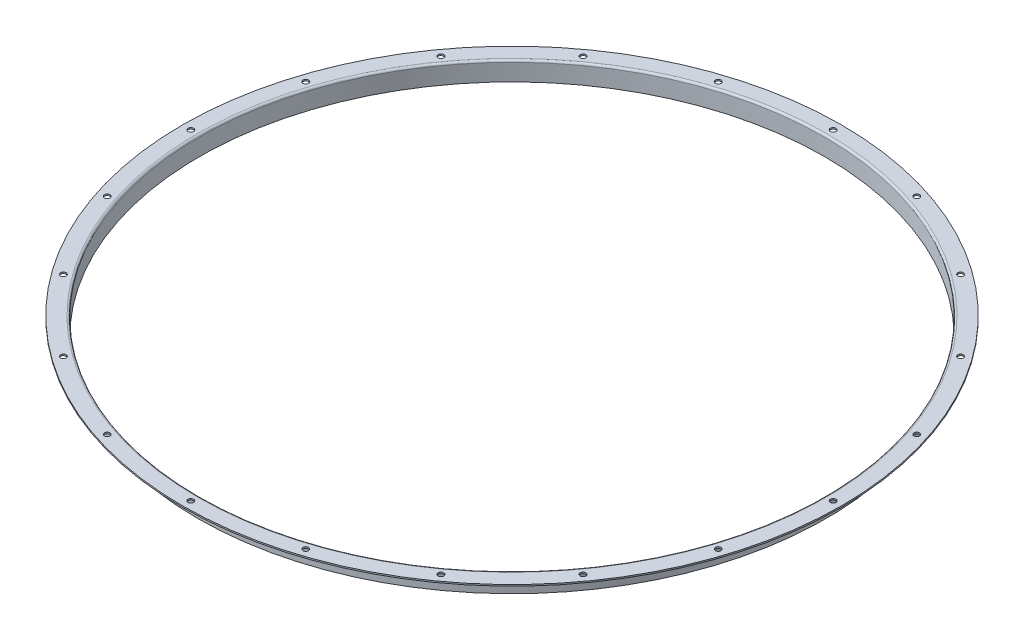
from build123d import *

# Parameters (mm, degrees)
SKETCH1_R          = 582.5
SKETCH1_R_2        = 552.5
BASE_FLANGE1_DEPTH = 2.5
SKETCH8_R          = 5
CUT_EXTRUDE1_DEPTH = 10


# Read off the part's stored shape, not the designer's step: Edge-Flange1
# Sheet-metal steps are written as plain solids
with BuildPart() as part:
    # Sketch1 → Base-Flange1 (new body)
    with BuildSketch(Plane(origin=(0, 0, 0), x_dir=(1, 0, 0), z_dir=(0, 1, 0))):
        with Locations(Location((0, 0, 0), (0, 0, 270))):
            Circle(SKETCH1_R)
        with Locations(Location((0, 0, 0), (0, 0, 270))):
            Circle(SKETCH1_R_2, mode=Mode.SUBTRACT)
    extrude(amount=-BASE_FLANGE1_DEPTH)

    # Edge-Flange1 outline → Edge-Flange1 (revolve, cut)
    with BuildSketch(Plane.XY):
        with BuildLine():
            Line((552.5, -2.5), (552.645898034, -2.5))
            ThreePointArc((552.645898034, -2.5), (553.908349934, -0.69375696), (556, 0))
            Line((556, 0), (552.5, 0))
            Line((552.5, 0), (552.5, -2.5))
        make_face()
    revolve(axis=Axis((0, 0, 0), (0, 1, 0)), mode=Mode.SUBTRACT)

    # Edge-Flange1 2 outline → Edge-Flange1 2 (revolve)
    with BuildSketch(Plane.XY):
        with BuildLine():
            Line((552.5, -3.5), (552.5, -33.5))
            Line((552.5, -33.5), (555, -33.5))
            Line((555, -33.5), (555, -3.5))
            ThreePointArc((555, -3.5), (555.292893219, -2.792893219), (556, -2.5))
            Line((556, -2.5), (552.645898034, -2.5))
            ThreePointArc((552.645898034, -2.5), (552.536666571, -2.994706462), (552.5, -3.5))
        make_face()
    revolve(axis=Axis((0, 0, 0), (0, 1, 0)))

    # Sketch8 → Cut-Extrude1 (cut)
    with BuildSketch(Plane(origin=(0, 0, 0), x_dir=(1, 0, 0), z_dir=(0, 1, 0))):
        with Locations(Location((175.367144308, 539.724572998, 0), (0, 0, 270))):
            Circle(SKETCH8_R)
        with Locations(Location((333.568130676, 459.117144308, 0), (0, 0, 270))):
            Circle(SKETCH8_R)
        with Locations(Location((0, 567.5, 0), (0, 0, 270))):
            Circle(SKETCH8_R)
        with Locations(Location((459.117144308, 333.568130676, 0), (0, 0, 270))):
            Circle(SKETCH8_R)
        with Locations(Location((539.724572998, 175.367144308, 0), (0, 0, 270))):
            Circle(SKETCH8_R)
        with Locations(Location((567.5, 0, 0), (0, 0, 270))):
            Circle(SKETCH8_R)
        with Locations(Location((539.724572998, -175.367144308, 0), (0, 0, 270))):
            Circle(SKETCH8_R)
        with Locations(Location((459.117144308, -333.568130676, 0), (0, 0, 270))):
            Circle(SKETCH8_R)
        with Locations(Location((333.568130676, -459.117144308, 0), (0, 0, 270))):
            Circle(SKETCH8_R)
        with Locations(Location((175.367144308, -539.724572997, 0), (0, 0, 270))):
            Circle(SKETCH8_R)
        with Locations(Location((0, -567.5, 0), (0, 0, 270))):
            Circle(SKETCH8_R)
        with Locations(Location((-175.367144308, -539.724572998, 0), (0, 0, 270))):
            Circle(SKETCH8_R)
        with Locations(Location((-333.568130676, -459.117144308, 0), (0, 0, 270))):
            Circle(SKETCH8_R)
        with Locations(Location((-459.117144308, -333.568130676, 0), (0, 0, 270))):
            Circle(SKETCH8_R)
        with Locations(Location((-539.724572997, -175.367144308, 0), (0, 0, 270))):
            Circle(SKETCH8_R)
        with Locations(Location((-567.5, 0, 0), (0, 0, 270))):
            Circle(SKETCH8_R)
        with Locations(Location((-539.724572997, 175.367144308, 0), (0, 0, 270))):
            Circle(SKETCH8_R)
        with Locations(Location((-459.117144308, 333.568130676, 0), (0, 0, 270))):
            Circle(SKETCH8_R)
        with Locations(Location((-333.568130676, 459.117144308, 0), (0, 0, 270))):
            Circle(SKETCH8_R)
        with Locations(Location((-175.367144308, 539.724572997, 0), (0, 0, 270))):
            Circle(SKETCH8_R)
    extrude(amount=-CUT_EXTRUDE1_DEPTH, mode=Mode.SUBTRACT)


solid = part.part
